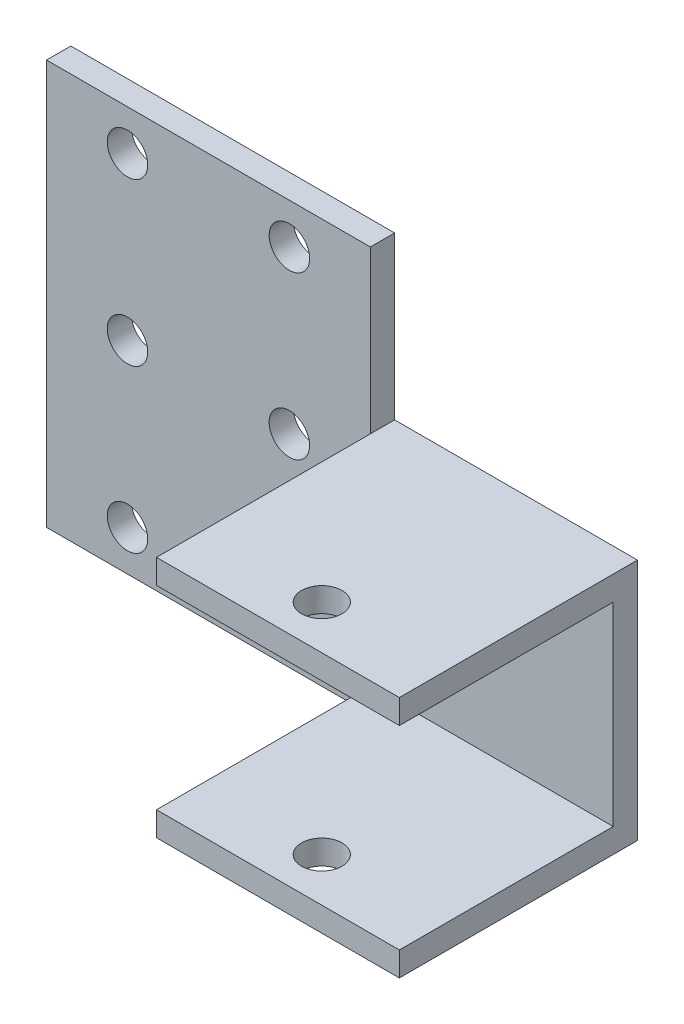
from build123d import *

# Parameters (mm, degrees)
SKETCH1_W               = 40
SKETCH1_H               = 50
SKETCH1_R               = 2.5
BOSS_EXTRUDE1_DEPTH     = 3
BOSS_EXTRUDE2_DEPTH     = 30
CUT_EXTRUDE1_DEPTH      = 81.587975335
CUT_EXTRUDE1_DEPTH_BACK = 81.587975335
SKETCH3_R               = 2.5


with BuildPart() as part:
    # Sketch1 → Boss-Extrude1 (new body)
    with BuildSketch(Plane.XY):
        with Locations((20, 25)):
            Rectangle(SKETCH1_W, SKETCH1_H)
        with Locations((30, 45)):
            Circle(SKETCH1_R, mode=Mode.SUBTRACT)
        with Locations((10, 45)):
            Circle(SKETCH1_R, mode=Mode.SUBTRACT)
        with Locations((10, 25)):
            Circle(SKETCH1_R, mode=Mode.SUBTRACT)
        with Locations((10, 5)):
            Circle(SKETCH1_R, mode=Mode.SUBTRACT)
        with Locations((30, 25)):
            Circle(SKETCH1_R, mode=Mode.SUBTRACT)
        with Locations((30, 5)):
            Circle(SKETCH1_R, mode=Mode.SUBTRACT)
    extrude(amount=BOSS_EXTRUDE1_DEPTH)

    # Sketch2 → Boss-Extrude2 (add)
    with BuildSketch(Plane(origin=(40, 0, 0), x_dir=(0, 0, -1), z_dir=(1, 0, 0))):
        Polygon((0, 0), (-29.414279899, 0), (-29.414279899, 3), (-3, 3), (-3, 27.004109069), (-29.414279899, 27.004109069), (-29.414279899, 30.004109069), (0, 30.004109069), align=None)
    extrude(amount=BOSS_EXTRUDE2_DEPTH)

    # Sketch3 → Cut-Extrude1 (cut, two sides: drawn at the far end of the back side and taken through both)
    with BuildSketch(Plane.XZ.offset(-27.004109069).offset(-CUT_EXTRUDE1_DEPTH_BACK)):
        with Locations((55, 24)):
            Circle(SKETCH3_R)
    extrude(amount=CUT_EXTRUDE1_DEPTH + CUT_EXTRUDE1_DEPTH_BACK, mode=Mode.SUBTRACT)


solid = part.part
